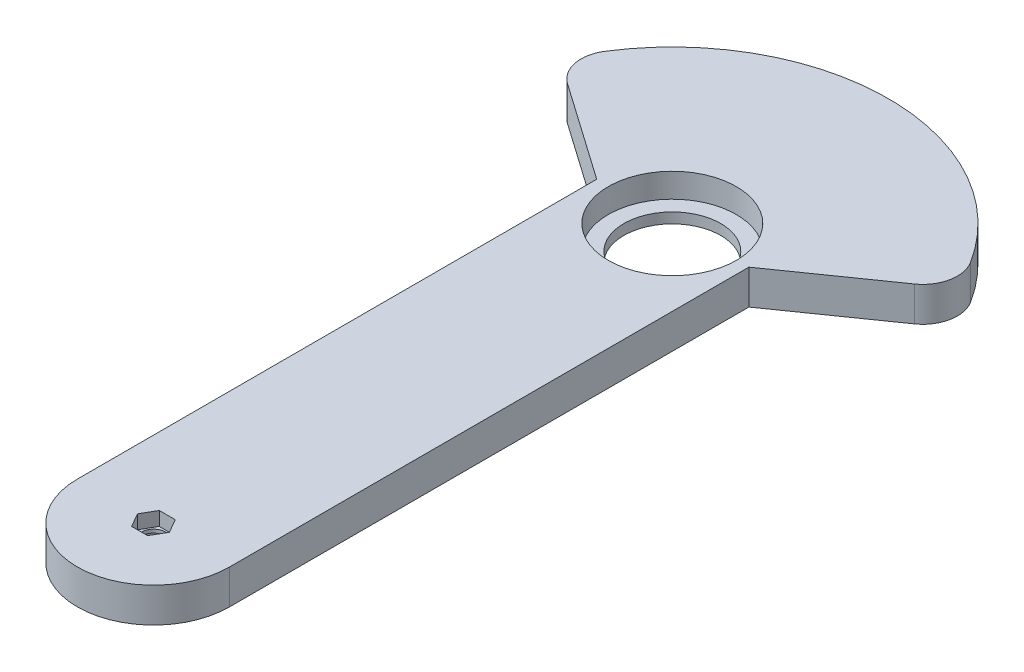
from build123d import *

# Parameters (mm, degrees)
BOSS_EXTRUDE1_DEPTH = 10
BOSS_EXTRUDE2_DEPTH = 10
SKETCH3_R           = 18.5
CUT_EXTRUDE1_DEPTH  = 7
SKETCH4_R           = 14
CUT_EXTRUDE2_DEPTH  = 181.671916356
SKETCH5_R           = 3.5
CUT_EXTRUDE3_DEPTH  = 181.671916356
SKETCH6_R           = 8
CUT_EXTRUDE4_DEPTH  = 5
CUT_EXTRUDE5_DEPTH  = 4


with BuildPart() as part:
    # Sketch1 → Boss-Extrude1 (new body)
    with BuildSketch(Plane(origin=(0, 0, 0), x_dir=(1, 0, 0), z_dir=(0, 1, 0))):
        with BuildLine():
            Line((-50.126401057, 19.839201524), (-7.169705454, -10.239400554))
            ThreePointArc((-7.169705454, -10.239400554), (0, -12.5), (7.169705454, -10.239400554))
            Line((7.169705454, -10.239400554), (50.126401057, 19.839201524))
            ThreePointArc((50.126401057, 19.839201524), (54.194564303, 26.060188175), (52.845996063, 33.369907103))
            ThreePointArc((52.845996063, 33.369907103), (0, 62.5), (-52.845996063, 33.369907103))
            ThreePointArc((-52.845996063, 33.369907103), (-54.194564303, 26.060188175), (-50.126401057, 19.839201524))
        make_face()
    extrude(amount=BOSS_EXTRUDE1_DEPTH)

    # Sketch2 → Boss-Extrude2 (add)
    with BuildSketch(Plane(origin=(0, 0, 0), x_dir=(1, 0, 0), z_dir=(0, 1, 0))):
        with BuildLine():
            Line((-22, 0.144883481), (-22, -150))
            ThreePointArc((-22, -150), (0, -172), (22, -150))
            Line((22, -150), (22, 0.144883481))
            Line((22, 0.144883481), (7.169705454, -10.239400554))
            ThreePointArc((7.169705454, -10.239400554), (0, -12.5), (-7.169705454, -10.239400554))
            Line((-7.169705454, -10.239400554), (-22, 0.144883481))
        make_face()
    extrude(amount=BOSS_EXTRUDE2_DEPTH)

    # Sketch3 → Cut-Extrude1 (cut)
    with BuildSketch(Plane(origin=(0, 10, 0), x_dir=(1, 0, 0), z_dir=(0, 1, 0))):
        Circle(SKETCH3_R)
    extrude(amount=-CUT_EXTRUDE1_DEPTH, mode=Mode.SUBTRACT)

    # Sketch4 → Cut-Extrude2 (cut, through all)
    with BuildSketch(Plane(origin=(0, 10, 0), x_dir=(1, 0, 0), z_dir=(0, 1, 0))):
        Circle(SKETCH4_R)
    extrude(amount=-CUT_EXTRUDE2_DEPTH, mode=Mode.SUBTRACT)

    # Sketch5 → Cut-Extrude3 (cut, through all)
    with BuildSketch(Plane(origin=(0, 10, 0), x_dir=(1, 0, 0), z_dir=(0, 1, 0))):
        with Locations((0, -150)):
            Circle(SKETCH5_R)
    extrude(amount=-CUT_EXTRUDE3_DEPTH, mode=Mode.SUBTRACT)

    # Sketch6 → Cut-Extrude4 (cut)
    with BuildSketch(Plane.XZ):
        with Locations((0, 150)):
            Circle(SKETCH6_R)
    extrude(amount=-CUT_EXTRUDE4_DEPTH, mode=Mode.SUBTRACT)

    # Sketch7 → Cut-Extrude5 (cut)
    with BuildSketch(Plane(origin=(0, 10, 0), x_dir=(1, 0, 0), z_dir=(0, 1, 0))):
        Polygon((4.618802154, -150), (2.309401077, -146), (-2.309401077, -146), (-4.618802154, -150), (-2.309401077, -154), (2.309401077, -154), align=None)
    extrude(amount=-CUT_EXTRUDE5_DEPTH, mode=Mode.SUBTRACT)


solid = part.part
